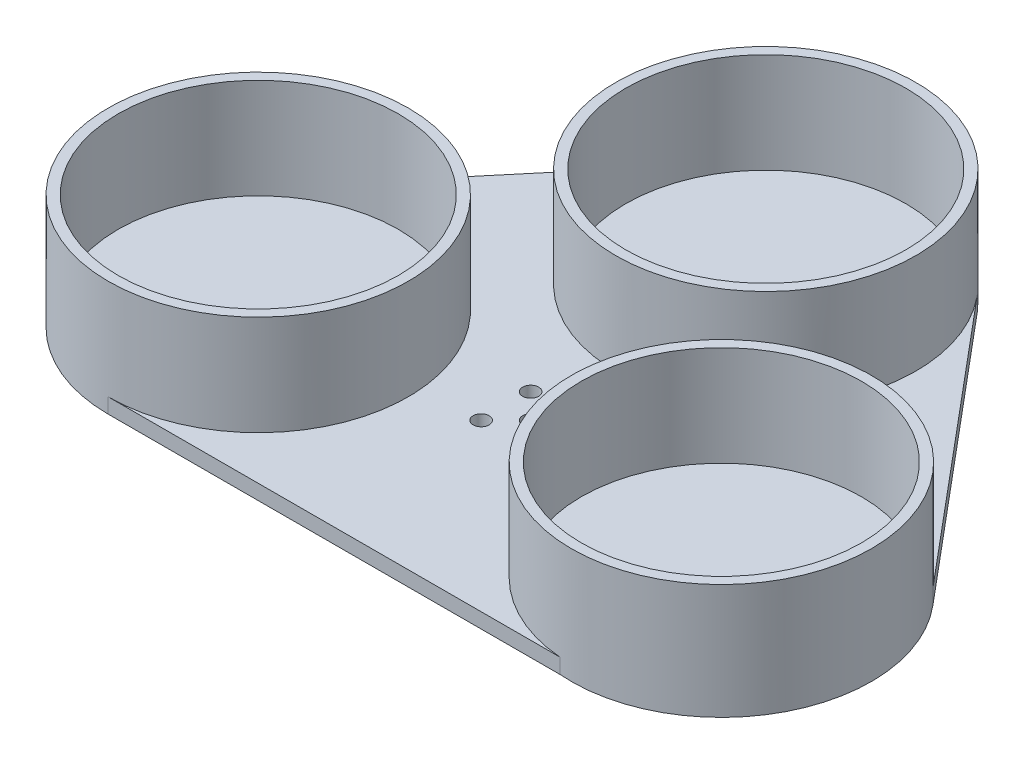
from build123d import *

# Parameters (mm, degrees)
EXTRUDE_1_DEPTH          = 3
EXTRUDE_START            = -3.0000001
EXTRUDE_2_OUTLINE_R      = 30
EXTRUDE_2_OUTLINE_R_2    = 28
EXTRUDE_2_DEPTH          = 23.0000001
CUT_EXTRUDE_1_DEPTH      = 120.66431532924713
CUT_EXTRUDE_1_DEPTH_BACK = 120.66431532924713
SKETCH_6_R               = 1.6000000000000003
SKETCH_6_R_2             = 1.5999999999999923
SKETCH_6_R_3             = 1.5999999999999999
SKETCH_6_R_4             = 1.5999999999999257
SKETCH_6_R_5             = 1.6


with BuildPart() as part:
    # 草图1 → 凸台-拉伸1 (new body)
    with BuildSketch(Plane(origin=(0, 0, 0), x_dir=(1, 0, 0), z_dir=(0, 1, 0))):
        with BuildLine():
            Line((69.26629435231834, 24.123359602578955), (22.672692502757357, 79.64558511919181))
            ThreePointArc((22.672692502757354, 79.64558511919181), (-0.2378402213252036, 89.99905718567035), (-22.981333293569364, 79.28362829059616))
            Line((-22.981333293569378, 79.28362829059616), (-69.26729768514315, 24.12216394025026))
            ThreePointArc((-69.26729768514312, 24.122163940250257), (-73.47519800267324, -7.84001220256689), (-46.285964391573756, -25.161464350345888))
            Line((-46.28596439157374, -25.161464350345884), (43.8875404004589, -25.065436701169876))
            ThreePointArc((43.887540400458896, -25.065436701169865), (72.946574545668, -8.916894776595973), (69.26629435231834, 24.12335960257895))
        make_face()
    extrude(amount=EXTRUDE_1_DEPTH)

    # 凸台-拉伸2: read off the stored shape, not the designer's step
    # 凸台-拉伸2 outline → 凸台-拉伸2 (add)
    # profile 1 of 3: a face of its own
    with BuildSketch(Plane(origin=(0, 3, 0), x_dir=(1, 0, 0), z_dir=(0, 1, 0)).offset(EXTRUDE_START)):
        with Locations((-46.285964392, 4.83853565)):
            Circle(EXTRUDE_2_OUTLINE_R)
        with Locations((-46.285964392, 4.83853565)):
            Circle(EXTRUDE_2_OUTLINE_R_2, mode=Mode.SUBTRACT)
    # profile 2 of 3: a face of its own
    with BuildSketch(Plane(origin=(0, 3, 0), x_dir=(1, 0, 0), z_dir=(0, 1, 0)).offset(EXTRUDE_START)):
        with Locations((46.285964392, 4.83853565)):
            Circle(EXTRUDE_2_OUTLINE_R)
        with Locations((46.285964392, 4.83853565)):
            Circle(EXTRUDE_2_OUTLINE_R_2, mode=Mode.SUBTRACT)
    # profile 3 of 3: a face of its own
    with BuildSketch(Plane(origin=(0, 3, 0), x_dir=(1, 0, 0), z_dir=(0, 1, 0)).offset(EXTRUDE_START)):
        with Locations((0, 60)):
            Circle(EXTRUDE_2_OUTLINE_R)
        with Locations((0, 60)):
            Circle(EXTRUDE_2_OUTLINE_R_2, mode=Mode.SUBTRACT)
    extrude(amount=EXTRUDE_2_DEPTH)

    # 草图6 → 切除-拉伸1 (cut, two sides: drawn at the far end of the back side and taken through both)
    with BuildSketch(Plane(origin=(0, 3, 0), x_dir=(1, 0, 0), z_dir=(0, 1, 0)).offset(-CUT_EXTRUDE_1_DEPTH_BACK)):
        with Locations(Location((0, 13, 0), (0, 0, 270))):
            Circle(SKETCH_6_R)
        with Locations(Location((4.9497474683058345, 17.949747468305834, 0), (0, 0, 270))):
            Circle(SKETCH_6_R_2)
        with Locations(Location((4.949747468305964, 8.050252531694156, 0), (0, 0, 270))):
            Circle(SKETCH_6_R_3)
        with Locations(Location((-4.949747468305834, 8.050252531694166, 0), (0, 0, 270))):
            Circle(SKETCH_6_R_4)
        with Locations(Location((-4.949747468305791, 17.949747468305738, 0), (0, 0, 270))):
            Circle(SKETCH_6_R_5)
    extrude(amount=CUT_EXTRUDE_1_DEPTH + CUT_EXTRUDE_1_DEPTH_BACK, mode=Mode.SUBTRACT)


solid = part.part
